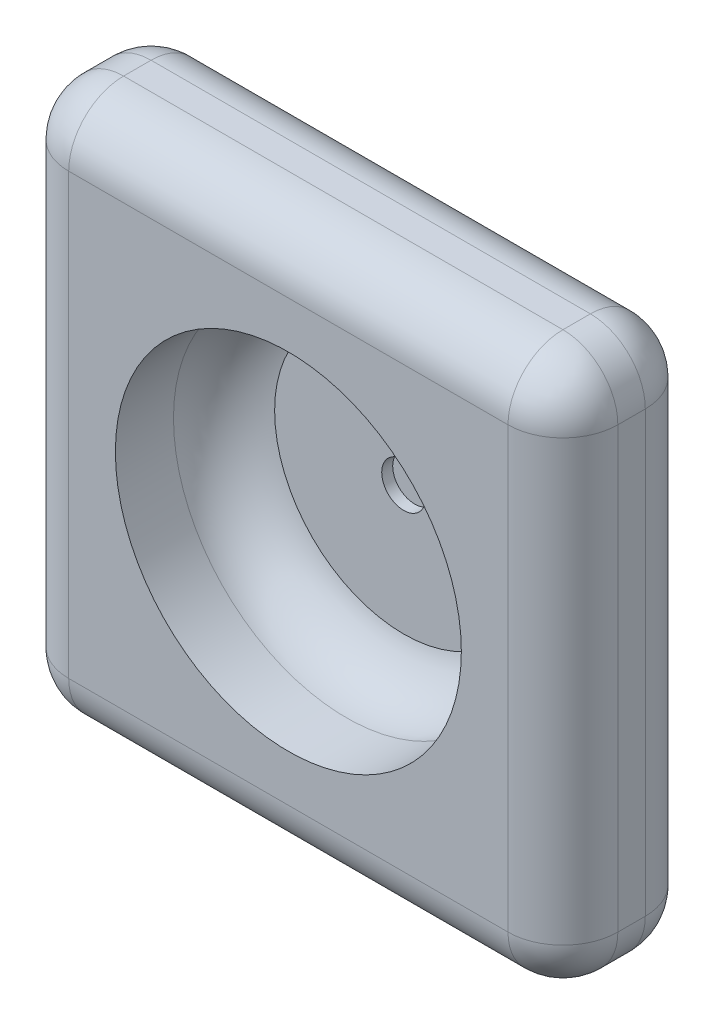
from build123d import *

# Parameters (mm, degrees)
SKETCH1_W           = 100
SKETCH1_H           = 100
BOSS_EXTRUDE1_DEPTH = 25
FILLET2_R           = 10
CUT_EXTRUDE1_START  = -2
SKETCH6_R           = 4
CUT_EXTRUDE1_DEPTH  = 3


with BuildPart() as part:
    # Sketch1 → Boss-Extrude1 (new body)
    with BuildSketch(Plane(origin=(0, 0, 0), x_dir=(0, 1, 0), z_dir=(0, 0, 1))):
        Rectangle(SKETCH1_W, SKETCH1_H)
    extrude(amount=BOSS_EXTRUDE1_DEPTH)

    # Sketch4 → Cut-Revolve2 (revolve, cut)
    with BuildSketch(Plane(origin=(0, 0, 0), x_dir=(0, -1, 0), z_dir=(-1, 0, 0))):
        with BuildLine():
            Line((0, 25), (0, 4))
            Line((0, 4), (-23.5, 4))
            ThreePointArc((-23.5, 4), (-29.269303538, 7.850991806), (-31.5, 14.41902001))
            Line((-31.5, 14.41902001), (-31.5, 25))
            Line((-31.5, 25), (0, 25))
        make_face()
    revolve(axis=Axis((0, 0, 0), (0, 0, 1)), mode=Mode.SUBTRACT)

    # Fillet2
    fillet2_edges = [part.edges().sort_by_distance(p)[0] for p in [
        (0, -50, 25),
        (0, -50, 0),
        (50, -50, 12.5),
        (50, 0, 25),
        (50, 0, 0),
        (-50, 0, 25),
        (-50, -50, 12.5),
        (-50, 0, 0),
        (50, 50, 12.5),
        (0, 50, 25),
        (-50, 50, 12.5),
        (0, 50, 0),
    ]]
    fillet(fillet2_edges, radius=FILLET2_R)

    # Sketch6 → Cut-Extrude1 (cut)
    with BuildSketch(Plane(origin=(0, 0, 0), x_dir=(1, 0, 0), z_dir=(0, 0, -1)).offset(CUT_EXTRUDE1_START)):
        Circle(SKETCH6_R)
    extrude(amount=-CUT_EXTRUDE1_DEPTH, mode=Mode.SUBTRACT)


solid = part.part
